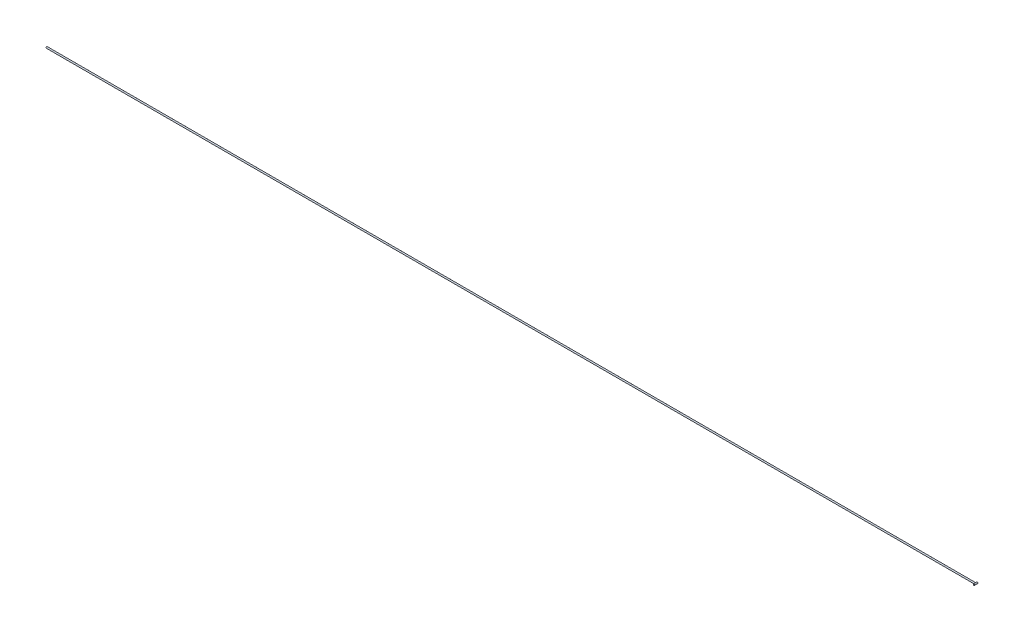
from build123d import *

# Parameters (mm, degrees)
BALAYAGE1_PROFILE_R = 1
BALAYAGE2_PROFILE_R = 1


with BuildPart() as part:
    # Balayage1: sweep along a path in Esquisse1
    with BuildLine(Plane.XY) as balayage1_path:
        Line((-687.5, 0), (687.5, 0))
    # Balayage1 profile (on start of the path) → Balayage1 (sweep)
    with BuildSketch(Plane(origin=(-687.5, 0, 0), x_dir=(0, 0, 1), z_dir=(1, 0, 0))):
        Circle(BALAYAGE1_PROFILE_R)
    sweep(path=balayage1_path.line)

    # Balayage2: sweep along a path in Esquisse16
    with BuildLine(Plane(origin=(687.5, 0, 0), x_dir=(0, 0, -1), z_dir=(1, 0, 0))) as balayage2_path:
        Line((-2.5, 0), (2.5, 0))
    # Balayage2 profile (on start of the path) → Balayage2 (sweep)
    with BuildSketch(Plane(origin=(687.5, 0, 2.5), x_dir=(-1, 0, 0), z_dir=(0, 0, -1))):
        Circle(BALAYAGE2_PROFILE_R)
    sweep(path=balayage2_path.line)


solid = part.part
